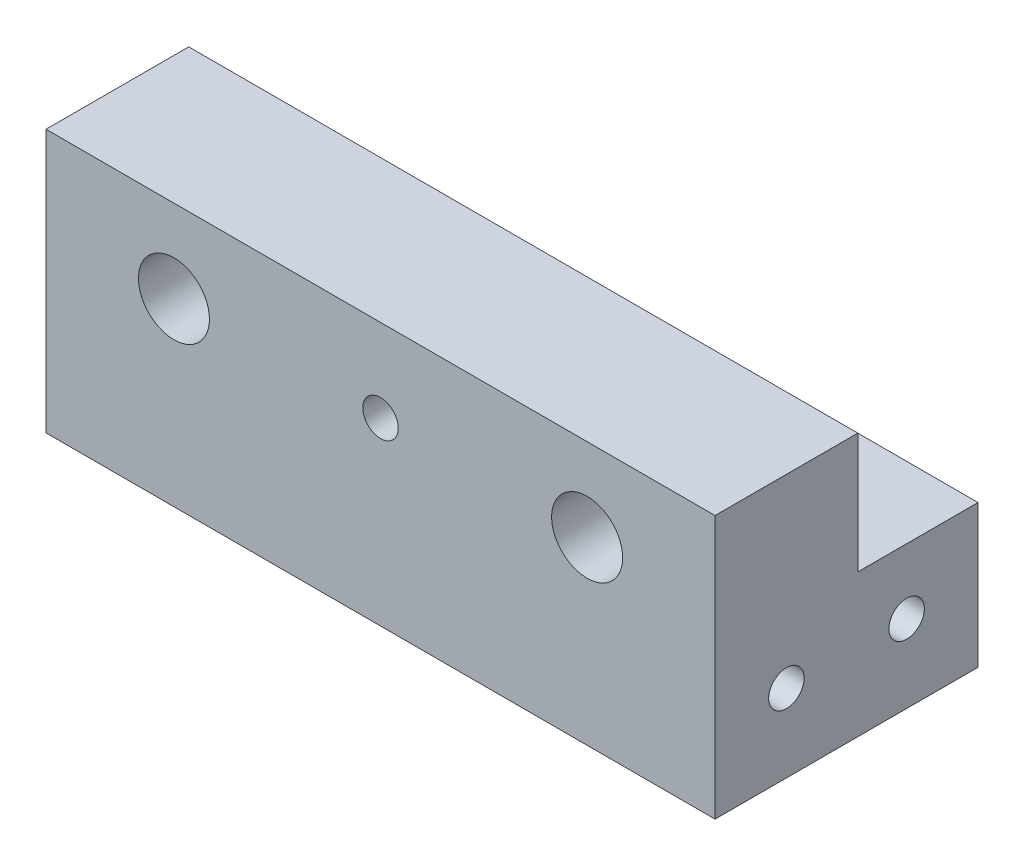
from build123d import *

# Parameters (mm, degrees)
SKETCH1_W           = 56.55
SKETCH1_H           = 22.225
BOSS_EXTRUDE1_DEPTH = 22.225
SKETCH2_R           = 3
SKETCH2_R_2         = 1.5
CUT_EXTRUDE1_DEPTH  = 10
SKETCH3_R           = 1.5
CUT_EXTRUDE2_DEPTH  = 62.768444867
SKETCH4_W           = 10.16
SKETCH4_H           = 10.16
CUT_EXTRUDE3_DEPTH  = 62.768444867


with BuildPart() as part:
    # Sketch1 → Boss-Extrude1 (new body)
    with BuildSketch(Plane.XY):
        Rectangle(SKETCH1_W, SKETCH1_H)
    extrude(amount=BOSS_EXTRUDE1_DEPTH)

    # Sketch2 → Cut-Extrude1 (cut)
    with BuildSketch(Plane.XY.offset(22.225)):
        with Locations((17.4625, 4.1125)):
            Circle(SKETCH2_R)
        with Locations((-17.4625, 4.1125)):
            Circle(SKETCH2_R)
        with Locations((0, 4.1125)):
            Circle(SKETCH2_R_2)
    extrude(amount=-CUT_EXTRUDE1_DEPTH, mode=Mode.SUBTRACT)

    # Sketch3 → Cut-Extrude2 (cut, through all)
    with BuildSketch(Plane.ZY.offset(28.275)):
        with Locations((16.1925, -4.5375001)):
            Circle(SKETCH3_R)
        with Locations((6.0325, -4.5375001)):
            Circle(SKETCH3_R)
    extrude(amount=-CUT_EXTRUDE2_DEPTH, mode=Mode.SUBTRACT)

    # Sketch4 → Cut-Extrude3 (cut, through all)
    with BuildSketch(Plane.ZY.offset(28.275)):
        with Locations((5.08, 6.0325)):
            Rectangle(SKETCH4_W, SKETCH4_H)
    extrude(amount=-CUT_EXTRUDE3_DEPTH, mode=Mode.SUBTRACT)


solid = part.part
